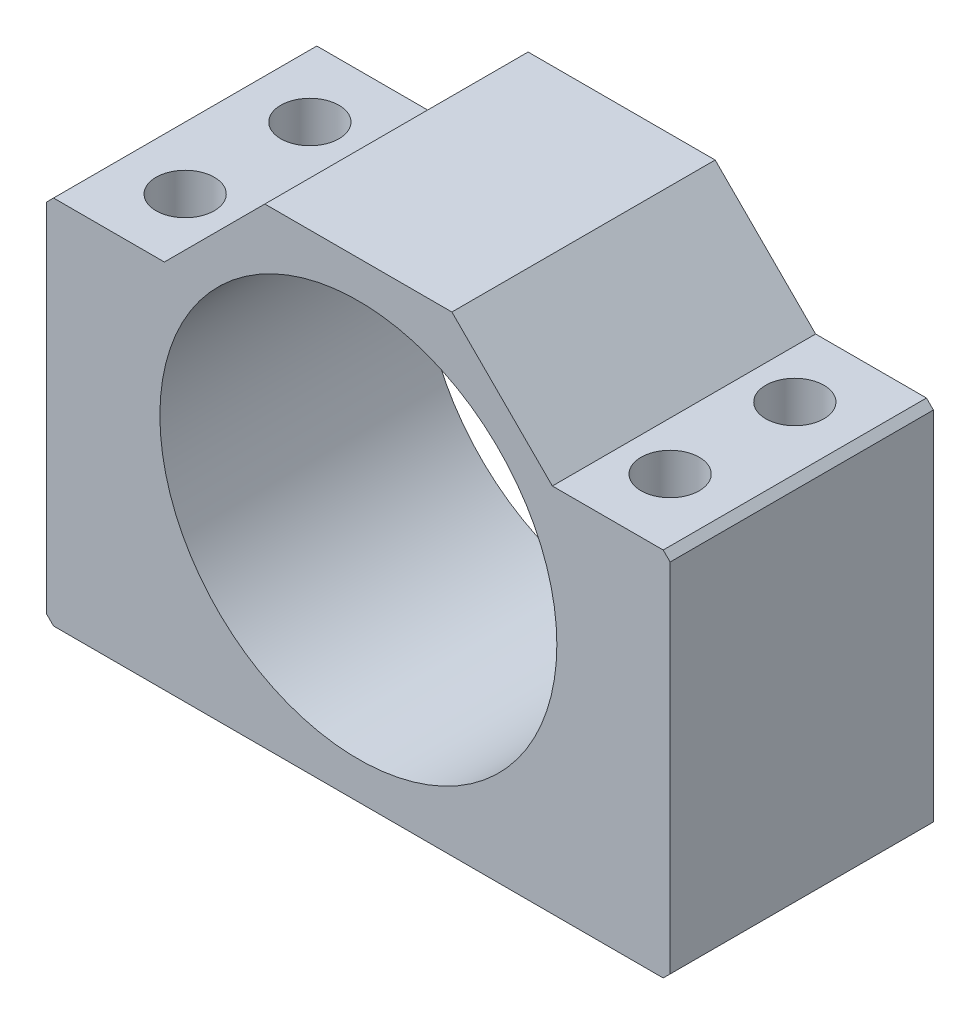
from build123d import *

# Parameters (mm, degrees)
SKETCH1_W            = 90
SKETCH1_H            = 68
SKETCH1_R            = 28.65
BOSS_EXTRUDE1_DEPTH  = 19
M8_CLEARANCE_HOLE1_D = 8.4
CUT_EXTRUDE2_DEPTH   = 69.007352544
CHAMFER1_SIZE        = 1


with BuildPart() as part:
    # Sketch1 → Boss-Extrude1 (new, symmetric)
    with BuildSketch(Plane.XY):
        Rectangle(SKETCH1_W, SKETCH1_H)
        Circle(SKETCH1_R, mode=Mode.SUBTRACT)
    extrude(amount=BOSS_EXTRUDE1_DEPTH, both=True)

    # M8 Clearance Hole1 (through all)
    with Locations(Plane(origin=(0, 34, 0), x_dir=(1, 0, 0), z_dir=(0, 1, 0))):
        with Locations((-35, 9), (-35, -9), (35, -9), (35, 9)):
            Hole(M8_CLEARANCE_HOLE1_D / 2)

    # Sketch3 → Cut-Extrude2 (cut, through all)
    with BuildSketch(Plane.XY.offset(19)):
        Polygon((-45, 19.5), (-28, 19.5), (-13.5, 34), (-45, 34), align=None)
        Polygon((45, 19.5), (28, 19.5), (13.5, 34), (45, 34), align=None)
    extrude(amount=-CUT_EXTRUDE2_DEPTH, mode=Mode.SUBTRACT)

    # Chamfer1
    chamfer1_edges = [part.edges().sort_by_distance(p)[0] for p in [
        (-45, 19.5, 0),
        (45, 19.5, 0),
        (45, -34, 0),
        (-45, -34, 0),
    ]]
    chamfer(chamfer1_edges, length=CHAMFER1_SIZE)


solid = part.part
